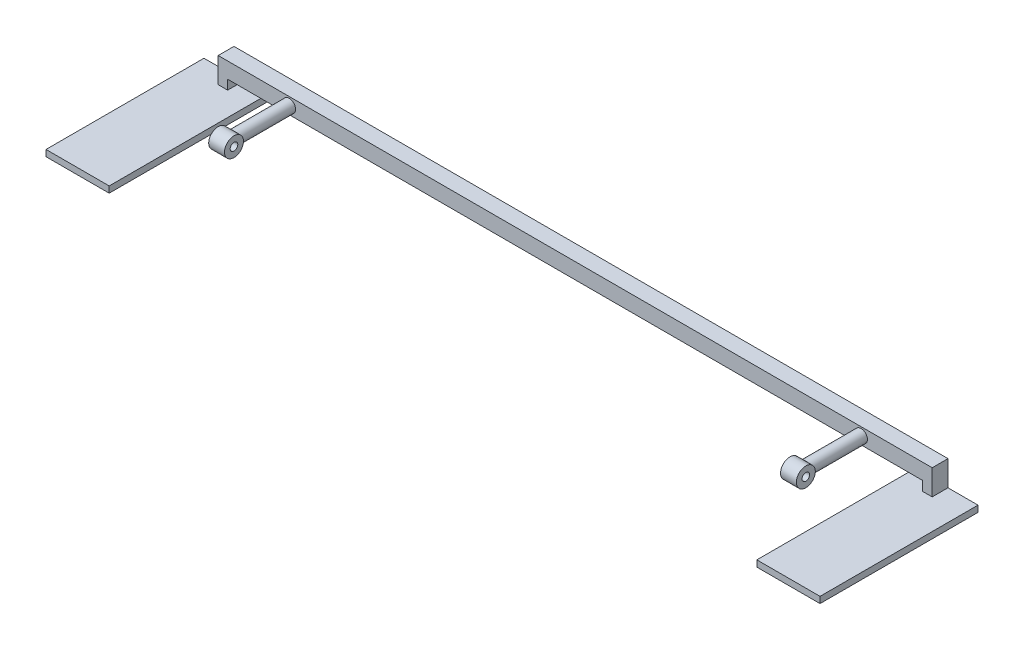
from build123d import *

# Parameters (mm, degrees)
BOSS_EXTRUDE1_DEPTH = 50
SKETCH2_W           = 200
SKETCH2_H           = 20
BOSS_EXTRUDE2_DEPTH = 500
SKETCH4_R           = 20
BOSS_EXTRUDE3_DEPTH = 200
SKETCH6_R           = 30
SKETCH6_R_2         = 12
BOSS_EXTRUDE4_DEPTH = 25
DELETEFACE2_START   = -925.0000001
DELETEFACE2_DEPTH   = 1850.0000001
FILLET1_R           = 2


# Read off the part's stored shape, not the designer's step: DeleteFace2
with BuildPart() as part:
    # Sketch1 → Boss-Extrude1 (new body)
    with BuildSketch(Plane.XY):
        Polygon((-1130, 0), (1130, 0), (1130, -80), (1100, -80), (1100, -50), (-1100, -50), (-1100, -80), (-1130, -80), align=None)
    extrude(amount=BOSS_EXTRUDE1_DEPTH)

    # Sketch2 → Boss-Extrude2 (add)
    with BuildSketch(Plane.XY):
        with Locations((-1125, -90)):
            Rectangle(SKETCH2_W, SKETCH2_H)
    boss_extrude2 = extrude(amount=BOSS_EXTRUDE2_DEPTH)

    # Sketch4 → Boss-Extrude3 (add)
    with BuildSketch(Plane.XY.offset(50)):
        with Locations(Location((-905, -25, 0), (0, 0, 180))):
            Circle(SKETCH4_R)
    boss_extrude3 = extrude(amount=BOSS_EXTRUDE3_DEPTH)

    # Sketch6 → Boss-Extrude4 (add, symmetric)
    with BuildSketch(Plane(origin=(-905, 0, 0), x_dir=(0, -1, 0), z_dir=(-1, 0, 0))):
        with Locations(Location((25, 250, 0), (0, 0, 90))):
            Circle(SKETCH6_R)
        with Locations(Location((25, 250, 0), (0, 0, 90))):
            Circle(SKETCH6_R_2, mode=Mode.SUBTRACT)
    boss_extrude4 = extrude(amount=BOSS_EXTRUDE4_DEPTH, both=True)

    # Mirror4: Boss-Extrude2, Boss-Extrude3, Boss-Extrude4 across plane
    add(boss_extrude2.mirror(Plane(origin=(0, 0, 0), x_dir=(0, 0, 1), z_dir=(1, 0, 0))))
    add(boss_extrude3.mirror(Plane(origin=(0, 0, 0), x_dir=(0, 0, 1), z_dir=(1, 0, 0))))
    add(boss_extrude4.mirror(Plane(origin=(0, 0, 0), x_dir=(0, 0, 1), z_dir=(1, 0, 0))))

    # DeleteFace2 outline → DeleteFace2 (cut)
    with BuildSketch(Plane.YZ.offset(DELETEFACE2_START)):
        with BuildLine():
            ThreePointArc((-37, 250), (-25, 238), (-13, 250))
            Line((-13, 250), (-37, 250))
        make_face()
    extrude(amount=DELETEFACE2_DEPTH, mode=Mode.SUBTRACT)

    # Fillet1
    fillet1_edges = [part.edges().sort_by_distance(p)[0] for p in [
        (-885, -25, 220),
        (885, -25, 220),
    ]]
    fillet(fillet1_edges, radius=FILLET1_R)


solid = part.part
